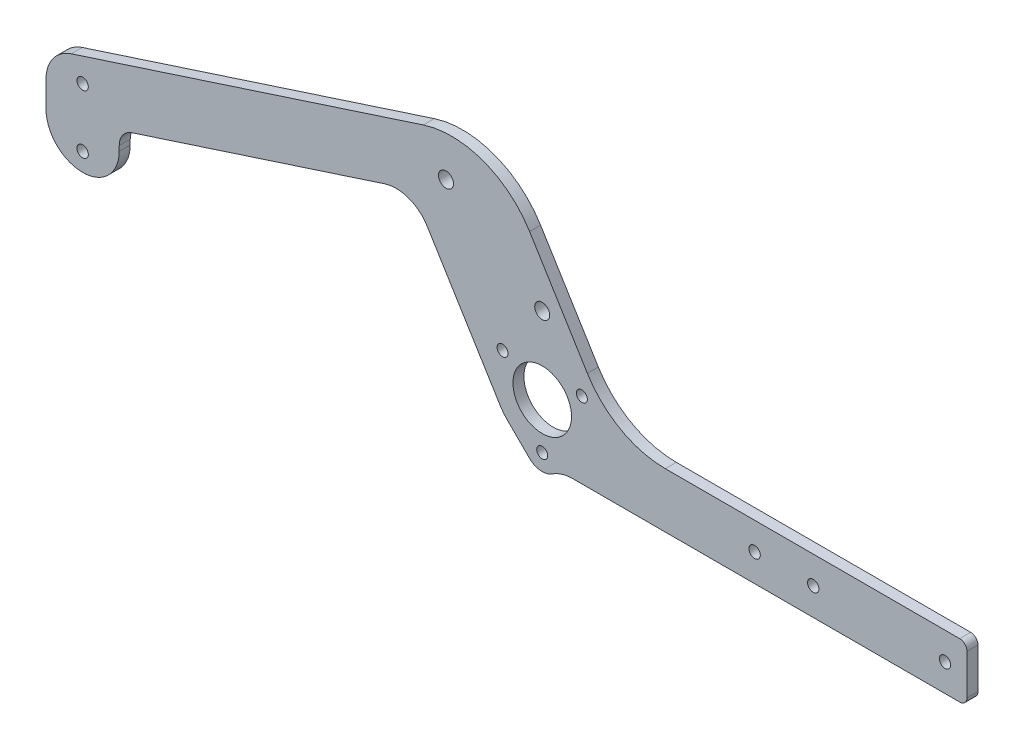
from build123d import *

# Parameters (mm, degrees)
SKETCH_1_R             = 1.55
SKETCH_1_R_2           = 8
SKETCH_1_R_3           = 1.5
SKETCH_1_R_4           = 2.05
EXTRUDE_7138_DEPTH     = 1.5
FILLET_26_R            = 25
FILLET_27_R            = 10
FILLET_29_R            = 25
FILLET_30_R            = 10
FILLET_32_R            = 5
SKETCH_2_R             = 2.05
CUT_EXTRUDE_8743_DEPTH = 145.450572029
FILLET_33_R            = 2


with BuildPart() as part:
    # Sketch 1 → Extrude 7138 (new, symmetric)
    with BuildSketch(Plane.XY):
        with BuildLine():
            Line((3.355098134, 27), (19.641206154, 0.5))
            Line((19.641206154, 0.5), (116, 0.5))
            Line((116, 0.5), (116, -14.5))
            Line((116, -14.5), (4.489247676, -14.5))
            Line((4.489247676, -14.5), (3.68981039, -15.374210914))
            ThreePointArc((3.68981039, -15.374210914), (0.115948236, -16.99865542), (-3.529390489, -15.541666667))
            Line((-3.529390489, -15.541666667), (-9.52935432, -9.5625))
            ThreePointArc((-9.52935432, -9.5625), (-10.589140426, -8.373774838), (-11.501566712, -7.068519164))
            Line((-11.501566712, -7.068519164), (-35.502480718, 31.984655506))
            Line((-35.502480718, 31.984655506), (-115.5, 5.991885841))
            Line((-115.5, 5.991885841), (-115.5, 1))
            ThreePointArc((-115.5, 1), (-125.5, -9), (-135.5, 1))
            Line((-135.5, 1), (-135.5, 8))
            ThreePointArc((-135.5, 8), (-133.590169944, 13.877852523), (-128.590169944, 17.510565163))
            Line((-128.590169944, 17.510565163), (-15.990382148, 54.09645401))
            Line((-15.990382148, 54.09645401), (-13.745786812, 54.825767244))
            Line((-13.745786812, 54.825767244), (3.355098134, 27))
        make_face()
        with Locations((-125.5, -4)):
            Circle(SKETCH_1_R, mode=Mode.SUBTRACT)
        with Locations((-125.5, 12)):
            Circle(SKETCH_1_R, mode=Mode.SUBTRACT)
        Circle(SKETCH_1_R_2, mode=Mode.SUBTRACT)
        with Locations((0, -12.5)):
            Circle(SKETCH_1_R_3, mode=Mode.SUBTRACT)
        with Locations((-10.825317547, 6.25)):
            Circle(SKETCH_1_R_3, mode=Mode.SUBTRACT)
        with Locations((10.825317547, 6.25)):
            Circle(SKETCH_1_R_3, mode=Mode.SUBTRACT)
        with Locations((110, -7)):
            Circle(SKETCH_1_R, mode=Mode.SUBTRACT)
        with Locations((58, -7)):
            Circle(SKETCH_1_R, mode=Mode.SUBTRACT)
        with Locations((0, 21)):
            Circle(SKETCH_1_R_4, mode=Mode.SUBTRACT)
        with Locations((74, -7)):
            Circle(SKETCH_1_R, mode=Mode.SUBTRACT)
    extrude(amount=EXTRUDE_7138_DEPTH, both=True)

    # Скругление26
    fillet_26_edges = [part.edges().sort_by_distance(p)[0] for p in [
        (-13.745786812, 54.825767244, 0),
    ]]
    fillet(fillet_26_edges, radius=FILLET_26_R)

    # Скругление27
    fillet_27_edges = [part.edges().sort_by_distance(p)[0] for p in [
        (-35.502480718, 31.984655506, 0),
    ]]
    fillet(fillet_27_edges, radius=FILLET_27_R)

    # Скругление29
    fillet_29_edges = [part.edges().sort_by_distance(p)[0] for p in [
        (19.641206154, 0.5, 0),
    ]]
    fillet(fillet_29_edges, radius=FILLET_29_R)

    # Скругление30
    fillet_30_edges = [part.edges().sort_by_distance(p)[0] for p in [
        (4.489247676, -14.5, 0),
    ]]
    fillet(fillet_30_edges, radius=FILLET_30_R)

    # Скругление32
    fillet_32_edges = [part.edges().sort_by_distance(p)[0] for p in [
        (-115.5, 5.991885841, 0),
    ]]
    fillet(fillet_32_edges, radius=FILLET_32_R)

    # Эскиз2 → Cut-Extrude 8743 (cut, through all)
    with BuildSketch(Plane(origin=(0, 0, -1.5), x_dir=(-1, 0, 0), z_dir=(0, 0, -1))):
        with Locations((26.273174879, 38.926428293)):
            Circle(SKETCH_2_R)
    extrude(amount=-CUT_EXTRUDE_8743_DEPTH, mode=Mode.SUBTRACT)

    # Скругление33
    fillet_33_edges = [part.edges().sort_by_distance(p)[0] for p in [
        (116, -14.5, 0),
        (116, 0.5, 0),
    ]]
    fillet(fillet_33_edges, radius=FILLET_33_R)


solid = part.part
